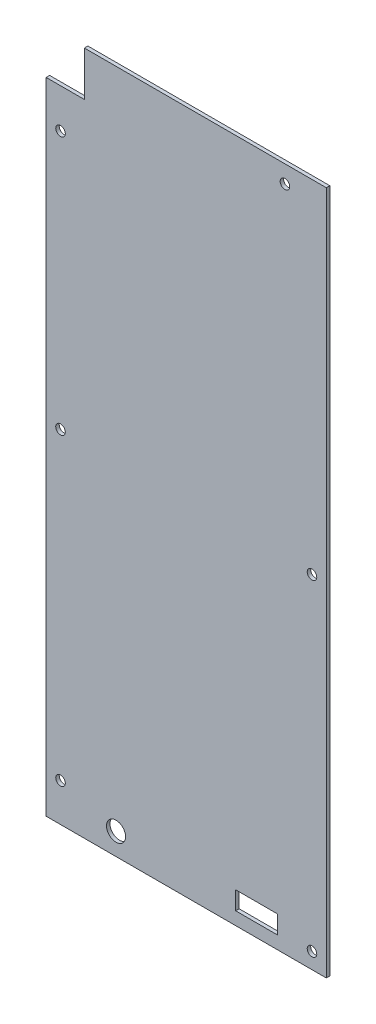
from build123d import *

# Parameters (mm, degrees)
SKETCH3_W              = 88
SKETCH3_H              = 215
BOSS_EXTRUDE3_DEPTH    = 1.1
CUT_EXTRUDE1_OUTLINE_W = 12
CUT_EXTRUDE1_OUTLINE_H = 13.99905087
CUT_EXTRUDE1_OUTLINE_R = 1.5
CUT_EXTRUDE1_DEPTH     = 1.1
SKETCH4_R              = 3
CUT_EXTRUDE2_DEPTH     = 1.1
SKETCH5_W              = 13.1
SKETCH5_H              = 5.72
CUT_EXTRUDE3_DEPTH     = 1.1


# Read off the part's stored shape, not the designer's step: Cut-Extrude1
with BuildPart() as part:
    # Sketch3 → Boss-Extrude3 (new body)
    with BuildSketch(Plane.XY):
        with Locations((0.594511969, -70.924817192)):
            Rectangle(SKETCH3_W, SKETCH3_H)
    extrude(amount=BOSS_EXTRUDE3_DEPTH)

    # Cut-Extrude1 outline → Cut-Extrude1 (cut)
    with BuildSketch(Plane.XY):
        with Locations((-37.405488031, 29.575657373)):
            Rectangle(CUT_EXTRUDE1_OUTLINE_W, CUT_EXTRUDE1_OUTLINE_H)
        with Locations((31.594511969, 31.075182808)):
            Circle(CUT_EXTRUDE1_OUTLINE_R)
        with Locations((-38.905488031, -166.424817192)):
            Circle(CUT_EXTRUDE1_OUTLINE_R)
        with Locations((-38.905488031, -70.924817192)):
            Circle(CUT_EXTRUDE1_OUTLINE_R)
        with Locations((-38.905488031, 10.255182808)):
            Circle(CUT_EXTRUDE1_OUTLINE_R)
        with Locations((40.094511969, -70.924817192)):
            Circle(CUT_EXTRUDE1_OUTLINE_R)
        with Locations((40.094511969, -173.424817192)):
            Circle(CUT_EXTRUDE1_OUTLINE_R)
    extrude(amount=CUT_EXTRUDE1_DEPTH, mode=Mode.SUBTRACT)

    # Sketch4 → Cut-Extrude2 (cut)
    with BuildSketch(Plane.XY.offset(1.1)):
        with Locations((-21.465488031, -171.524817192)):
            Circle(SKETCH4_R)
    extrude(amount=-CUT_EXTRUDE2_DEPTH, mode=Mode.SUBTRACT)

    # Sketch5 → Cut-Extrude3 (cut)
    with BuildSketch(Plane.XY.offset(1.1)):
        with Locations((22.654511969, -171.524817192)):
            Rectangle(SKETCH5_W, SKETCH5_H)
    extrude(amount=-CUT_EXTRUDE3_DEPTH, mode=Mode.SUBTRACT)


solid = part.part
